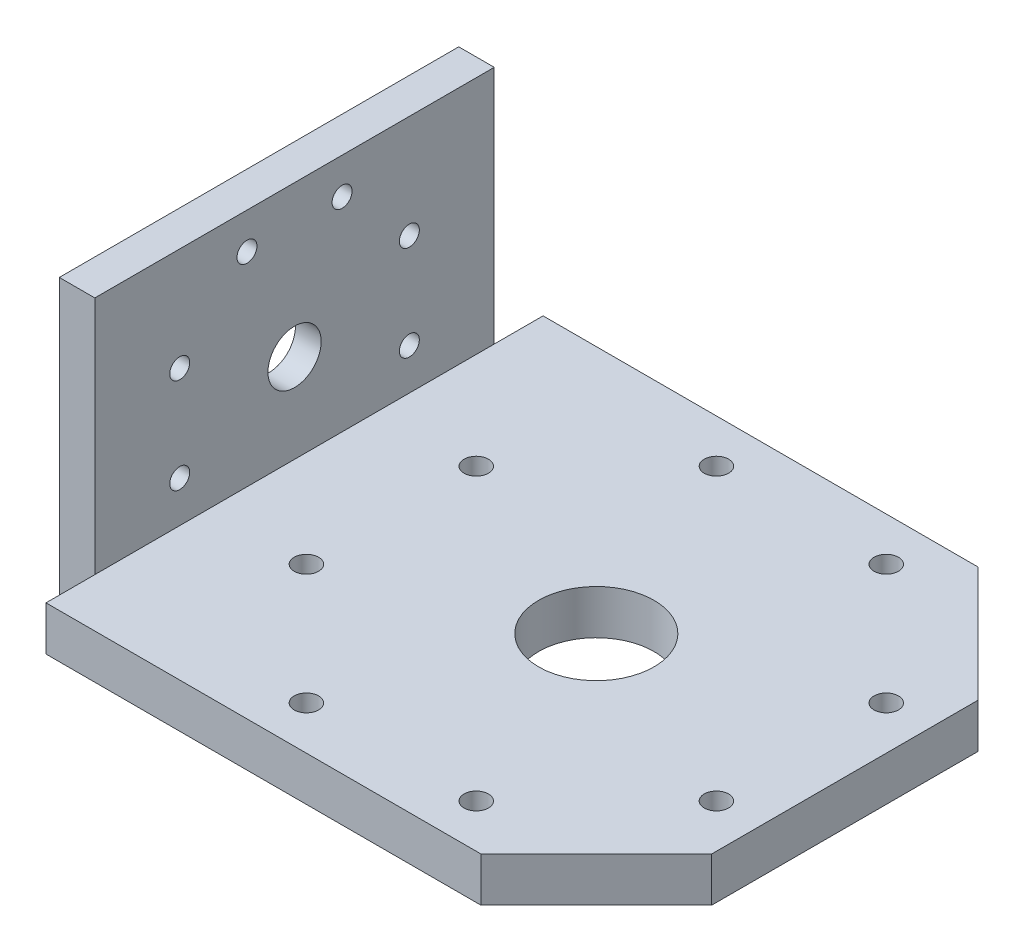
from build123d import *

# Parameters (mm, degrees)
SK_BACK_PLATE_W         = 90
SK_BACK_PLATE_H         = 70
SK_BACK_PLATE_R         = 2.25
SK_BACK_PLATE_R_2       = 6
BACK_PLATE_DEPTH        = 8
SK_ROLL_PILOT_RECESS_R  = 22.15
ROLL_PILOT_RECESS_DEPTH = 2.2
SK_MEDIAL_PLATE_R       = 2.75
SK_MEDIAL_PLATE_R_2     = 13
MEDIAL_PLATE_DEPTH      = 10


with BuildPart() as part:
    # SK_Back_Plate → Back_Plate (new body)
    with BuildSketch(Plane(origin=(-76, 0, 0), x_dir=(0, 0, -1), z_dir=(1, 0, 0))):
        with Locations((0, -1)):
            Rectangle(SK_BACK_PLATE_W, SK_BACK_PLATE_H)
        with Locations((25.86862691, 10.715136106)):
            Circle(SK_BACK_PLATE_R, mode=Mode.SUBTRACT)
        with Locations((10.715136106, 25.86862691)):
            Circle(SK_BACK_PLATE_R, mode=Mode.SUBTRACT)
        with Locations((-10.715136106, 25.86862691)):
            Circle(SK_BACK_PLATE_R, mode=Mode.SUBTRACT)
        with Locations((-25.86862691, 10.715136106)):
            Circle(SK_BACK_PLATE_R, mode=Mode.SUBTRACT)
        with Locations((-25.86862691, -10.715136106)):
            Circle(SK_BACK_PLATE_R, mode=Mode.SUBTRACT)
        with Locations((-10.715136106, -25.86862691)):
            Circle(SK_BACK_PLATE_R, mode=Mode.SUBTRACT)
        with Locations((10.715136106, -25.86862691)):
            Circle(SK_BACK_PLATE_R, mode=Mode.SUBTRACT)
        with Locations((25.86862691, -10.715136106)):
            Circle(SK_BACK_PLATE_R, mode=Mode.SUBTRACT)
        Circle(SK_BACK_PLATE_R_2, mode=Mode.SUBTRACT)
    extrude(amount=BACK_PLATE_DEPTH)

    # SK_Roll_Pilot_Recess → Roll_Pilot_Recess (cut)
    with BuildSketch(Plane(origin=(-76, 0, 0), x_dir=(0, 0, -1), z_dir=(1, 0, 0))):
        Circle(SK_ROLL_PILOT_RECESS_R)
    extrude(amount=ROLL_PILOT_RECESS_DEPTH, mode=Mode.SUBTRACT)

    # SK_Medial_Plate → Medial_Plate (add)
    with BuildSketch(Plane(origin=(0, -30, 0), x_dir=(1, 0, 0), z_dir=(0, 1, 0))):
        Polygon((-68, 56), (30, 56), (56, 30), (56, -30), (30, -56), (-68, -56), align=None)
        with Locations((46.193976626, 19.134171618)):
            Circle(SK_MEDIAL_PLATE_R, mode=Mode.SUBTRACT)
        with Locations((19.134171618, 46.193976626)):
            Circle(SK_MEDIAL_PLATE_R, mode=Mode.SUBTRACT)
        with Locations((-19.134171618, 46.193976626)):
            Circle(SK_MEDIAL_PLATE_R, mode=Mode.SUBTRACT)
        with Locations((-46.193976626, 19.134171618)):
            Circle(SK_MEDIAL_PLATE_R, mode=Mode.SUBTRACT)
        with Locations((-46.193976626, -19.134171618)):
            Circle(SK_MEDIAL_PLATE_R, mode=Mode.SUBTRACT)
        with Locations((-19.134171618, -46.193976626)):
            Circle(SK_MEDIAL_PLATE_R, mode=Mode.SUBTRACT)
        with Locations((19.134171618, -46.193976626)):
            Circle(SK_MEDIAL_PLATE_R, mode=Mode.SUBTRACT)
        with Locations((46.193976626, -19.134171618)):
            Circle(SK_MEDIAL_PLATE_R, mode=Mode.SUBTRACT)
        Circle(SK_MEDIAL_PLATE_R_2, mode=Mode.SUBTRACT)
    extrude(amount=MEDIAL_PLATE_DEPTH)


solid = part.part
